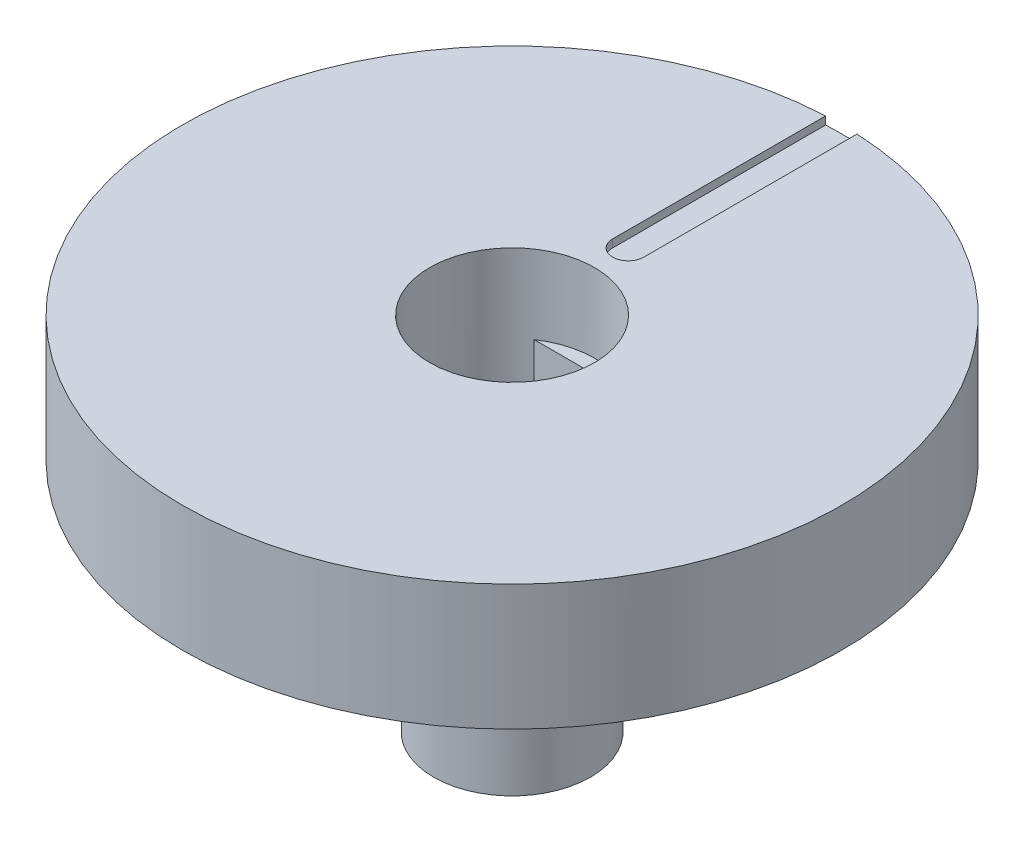
from build123d import *
from build123d.topology import SkipClean

# Parameters (mm, degrees)
SKETCH1_R           = 10.5
SKETCH1_R_2         = 8.6
BOSS_EXTRUDE1_DEPTH = 3.5
BOSS_EXTRUDE2_DEPTH = 1.25
BOSS_EXTRUDE3_START = 17.2
BOSS_EXTRUDE3_DEPTH = 1.25
BOSS_EXTRUDE4_START = 0.5
SKETCH3_R           = 10.5
BOSS_EXTRUDE4_DEPTH = 0.5
SKETCH5_R           = 3.25
BOSS_EXTRUDE5_DEPTH = 6
FILLET2_R           = 0.75
CUT_EXTRUDE1_DEPTH  = 5.5
FILLET1_R           = 0.25
SKETCH7_R           = 2.625
CUT_EXTRUDE2_DEPTH  = 2.5
CUT_EXTRUDE3_DEPTH  = 0.25
SKETCH11_R          = 2.5
BOSS_EXTRUDE6_DEPTH = 5
CUT_EXTRUDE4_START  = 5
CUT_EXTRUDE4_DEPTH  = 4.5
CHAMFER2_SIZE       = 0.25
FILLET3_R           = 5


with BuildPart() as part:
    # Sketch1 → Boss-Extrude1 (new body)
    with BuildSketch(Plane(origin=(0, 0, 0), x_dir=(1, 0, 0), z_dir=(0, 1, 0))):
        with Locations(Location((0, 0, 0), (0, 0, 270))):
            Circle(SKETCH1_R)
        with Locations(Location((0, 0, 0), (0, 0, 270))):
            Circle(SKETCH1_R_2, mode=Mode.SUBTRACT)
    extrude(amount=-BOSS_EXTRUDE1_DEPTH)

    # Sketch2 → Boss-Extrude2 (add)
    with BuildSketch(Plane(origin=(0, 0, 8.6), x_dir=(-1, 0, 0), z_dir=(0, 0, -1))):
        Polygon((0.4, -2.9), (-0.4, -2.9), (-0.4, -1), (-1.4, 0), (1.4, 0), (0.4, -1), align=None)
    extrude(amount=BOSS_EXTRUDE2_DEPTH)

    # Sketch2<2> → Boss-Extrude3 (add)
    with BuildSketch(Plane(origin=(0, 0, 8.6), x_dir=(-1, 0, 0), z_dir=(0, 0, -1)).offset(BOSS_EXTRUDE3_START)):
        Polygon((0.4, -2.9), (-0.4, -2.9), (-0.4, -1), (-1.4, 0), (1.4, 0), (0.4, -1), align=None)
    extrude(amount=-BOSS_EXTRUDE3_DEPTH)

    # Sketch3 → Boss-Extrude4 (add)
    with BuildSketch(Plane(origin=(0, 0, 0), x_dir=(1, 0, 0), z_dir=(0, 1, 0)).offset(BOSS_EXTRUDE4_START)):
        with Locations(Location((0, 0, 0), (0, 0, 270))):
            Circle(SKETCH3_R)
    extrude(amount=-BOSS_EXTRUDE4_DEPTH)

    # Sketch5 → Boss-Extrude5 (add)
    with BuildSketch(Plane.XZ):
        with Locations(Location((0, 0, 0), (0, 0, 90))):
            Circle(SKETCH5_R)
    extrude(amount=BOSS_EXTRUDE5_DEPTH)

    # Fillet2
    fillet2_edges = [part.edges().sort_by_distance(p)[0] for p in [
        (0, 0, -3.25),
    ]]
    fillet(fillet2_edges, radius=FILLET2_R)

    # Sketch4 → Cut-Extrude1 (cut)
    with BuildSketch(Plane(origin=(0, 0.5, 0), x_dir=(1, 0, 0), z_dir=(0, 1, 0))):
        with BuildLine():
            Line((-1.469693846, 2.175), (1.469693846, 2.175))
            ThreePointArc((1.469693846, 2.175), (0, -2.625), (-1.469693846, 2.175))
        make_face()
    extrude(amount=-CUT_EXTRUDE1_DEPTH, mode=Mode.SUBTRACT)

    # Fillet1
    fillet1_edges = [part.edges().sort_by_distance(p)[0] for p in [
        (-0.4, -2.9, 7.970346319),
        (0.4, -2.9, 7.970346319),
        (-0.4, -2.9, -7.970346319),
        (0.4, -2.9, -7.970346319),
    ]]
    fillet(fillet1_edges, radius=FILLET1_R)

    # Sketch7 → Cut-Extrude2 (cut)
    with SkipClean():  # the faces are left unmerged after this step: merging them gives an invalid solid
        with BuildSketch(Plane(origin=(0, 0.5, 0), x_dir=(1, 0, 0), z_dir=(0, 1, 0))):
            with Locations(Location((0, 0, 0), (0, 0, 270))):
                Circle(SKETCH7_R)
        extrude(amount=-CUT_EXTRUDE2_DEPTH, mode=Mode.SUBTRACT)

    # Sketch9 → Cut-Extrude3 (cut)
    with SkipClean():  # the faces are left unmerged after this step: merging them gives an invalid solid
        with BuildSketch(Plane(origin=(0, 0.5, 0), x_dir=(1, 0, 0), z_dir=(0, 1, 0))):
            with BuildLine():
                Line((-0.5, 3.7), (-0.5, 13.7))
                ThreePointArc((-0.5, 13.7), (0, 14.2), (0.5, 13.7))
                Line((0.5, 13.7), (0.5, 3.7))
                ThreePointArc((0.5, 3.7), (0, 3.2), (-0.5, 3.7))
            make_face()
        extrude(amount=-CUT_EXTRUDE3_DEPTH, mode=Mode.SUBTRACT)

    # Sketch11 → Boss-Extrude6 (add)
    with SkipClean():  # the faces are left unmerged after this step: merging them gives an invalid solid
        with BuildSketch(Plane.XZ.offset(6)):
            with Locations(Location((0, 0, 0), (0, 0, 270))):
                Circle(SKETCH11_R)
        extrude(amount=BOSS_EXTRUDE6_DEPTH)

    # Sketch10 → Cut-Extrude4 (cut)
    with SkipClean():  # the faces are left unmerged after this step: merging them gives an invalid solid
        with BuildSketch(Plane.XZ.offset(6).offset(CUT_EXTRUDE4_START)):
            Polygon((1.804219591, 0), (0.902109796, 1.5625), (-0.902109796, 1.5625), (-1.804219591, 0), (-0.902109796, -1.5625), (0.902109796, -1.5625), align=None)
        extrude(amount=-CUT_EXTRUDE4_DEPTH, mode=Mode.SUBTRACT)

    # Chamfer2
    chamfer2_edges = [part.edges().sort_by_distance(p)[0] for p in [
        (-1.353164693, -11, -0.78125),
        (-1.353164693, -11, 0.78125),
        (0, -11, 1.5625),
        (1.353164693, -11, 0.78125),
        (1.353164693, -11, -0.78125),
        (0, -11, -1.5625),
    ]]
    chamfer(chamfer2_edges, length=CHAMFER2_SIZE)

    # Fillet3
    # the kernel refuses this fillet: 5 mm, written as the material it adds along each edge
    with BuildSketch(Plane(origin=(0, -6, 0), x_dir=(0, 0, -1), z_dir=(-1, 0, 0))) as fillet3_piece_1:
        with BuildLine():
            CenterArc((7.5, 2.633913438), FILLET3_R, 180, 31.788330617)
            Line((3.25, 0), (3.165, -0.052678269))
            ThreePointArc((3.165, -0.052678269), (2.875, -0.1), (2.5, -0.1))
            Line((2.5, -0.1), (2.4, 0))
            Line((2.4, 0), (2.4, 2.633913438))
            Line((2.4, 2.633913438), (2.5, 2.633913438))
        make_face()
    revolve(axis=Axis((0, -6, 0), (0, -1, 0)))


solid = part.part
